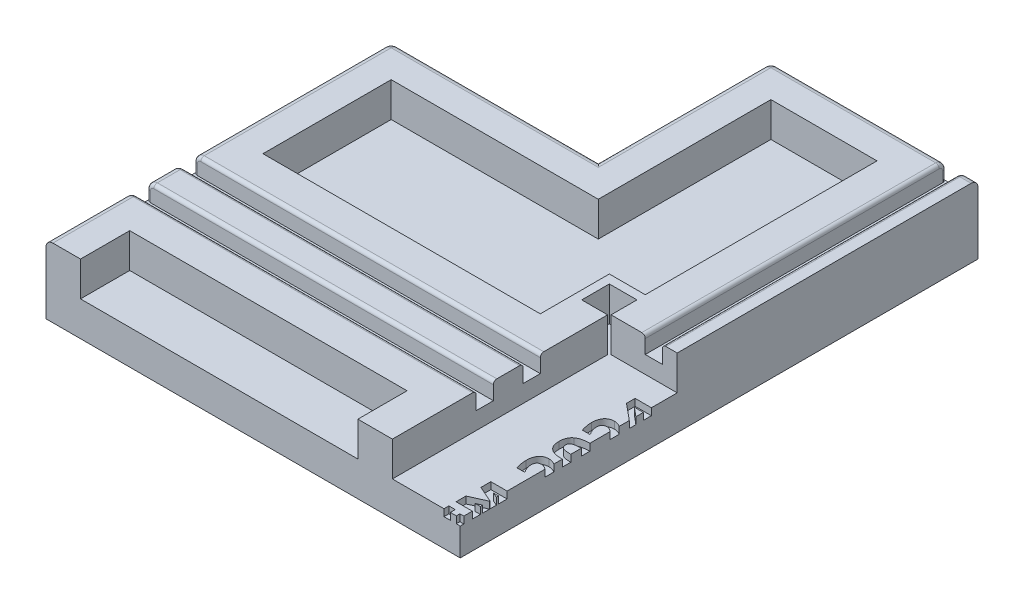
from build123d import *

# Parameters (mm, degrees)
SKETCH1_W                                  = 240
SKETCH1_H                                  = 200
BOSS_EXTRUDE1_DEPTH                        = 20
SKETCH7_W                                  = 120
SKETCH7_H                                  = 50
BOSS_EXTRUDE6_DEPTH                        = 20
FILLET1_R                                  = 2
SKETCH2_W                                  = 39.3
SKETCH2_H                                  = 125.7
CUT_EXTRUDE1_DEPTH                         = 10
CUT_EXTRUDE3_DEPTH                         = 5
MIRROR4_AT_THE_SECOND_PLANE_COPY_1_DEPTH   = 5
SKETCH11_W                                 = 104.748042719
SKETCH11_H                                 = 5
CUT_EXTRUDE4_DEPTH                         = 5
MIRROR6_AT_THE_SECOND_PLANE_COPY_1_SKETC_W = 104.748042719
MIRROR6_AT_THE_SECOND_PLANE_COPY_1_SKETC_H = 5
MIRROR6_AT_THE_SECOND_PLANE_COPY_1_DEPTH   = 5
SHELL1_START                               = 10
SHELL1_OUTLINE_W                           = 80.35
SHELL1_OUTLINE_H                           = 28.5
SHELL1_DEPTH                               = 10
FILLET3_R                                  = 1
SKETCH13_W                                 = 7.252545243
SKETCH13_H                                 = 2.335565418
SKETCH13_W_2                               = 1.720942939
SKETCH13_H_2                               = 2.581414408
CUT_EXTRUDE5_DEPTH                         = 2
CUT_EXTRUDE6_DEPTH                         = 10
MIRROR7_AT_THE_SECOND_PLANE_COPY_1_DEPTH   = 10
SKETCH15_W                                 = 266.75178719
SKETCH15_H                                 = 32.364197877
CUT_EXTRUDE7_DEPTH                         = 194.132079158
SKETCH16_W                                 = 161.662961075
SKETCH16_H                                 = 25.916642831
CUT_EXTRUDE8_DEPTH                         = 194.132079158


# Read off the part's stored shape, not the designer's step: Shell1
with BuildPart() as part:
    # Sketch1 → Boss-Extrude1 (new body)
    with BuildSketch(Plane(origin=(0, 0, 0), x_dir=(1, 0, 0), z_dir=(0, 1, 0))):
        Rectangle(SKETCH1_W, SKETCH1_H)
    extrude(amount=BOSS_EXTRUDE1_DEPTH)

    # Sketch7 → Boss-Extrude6 (add)
    with BuildSketch(Plane(origin=(0, 0, 0), x_dir=(1, 0, 0), z_dir=(0, 1, 0))):
        with Locations((0, 125)):
            Rectangle(SKETCH7_W, SKETCH7_H)
        with Locations((0, -125)):
            Rectangle(SKETCH7_W, SKETCH7_H)
    extrude(amount=BOSS_EXTRUDE6_DEPTH)

    # Fillet1
    fillet1_edges = [part.edges().sort_by_distance(p)[0] for p in [
        (-120, 20, 0),
        (90, 20, 100),
        (-90, 20, 100),
        (-60, 10, 150),
        (60, 10, 150),
        (-60, 20, 125),
        (0, 20, 150),
        (60, 20, 125),
        (-90, 20, -100),
        (60, 20, -125),
        (0, 20, -150),
        (60, 10, -150),
        (-60, 10, -150),
        (-60, 20, -125),
        (120, 20, 0),
        (120, 10, 100),
        (-120, 10, 100),
        (-120, 10, -100),
        (120, 10, -100),
        (90, 20, -100),
    ]]
    fillet(fillet1_edges, radius=FILLET1_R)

    # Sketch2 → Cut-Extrude1 (cut)
    with BuildSketch(Plane(origin=(0, 20, 0), x_dir=(1, 0, 0), z_dir=(0, 1, 0))):
        Rectangle(SKETCH2_W, SKETCH2_H)
    extrude(amount=-CUT_EXTRUDE1_DEPTH, mode=Mode.SUBTRACT)

    # Sketch10 → Cut-Extrude3 (cut)
    with BuildSketch(Plane(origin=(0, 20, 0), x_dir=(1, 0, 0), z_dir=(0, 1, 0))):
        Polygon((-9.25, -40.5), (-9.25, -33.162899401), (-4.25, -33.162899401), (-4.25, -40.5), (-4.25, -156.832928994), (-9.25, -156.832928994), align=None)
    cut_extrude3 = extrude(amount=-CUT_EXTRUDE3_DEPTH, mode=Mode.SUBTRACT)

    # Mirror4: Cut-Extrude3 across plane
    add(cut_extrude3.mirror(Plane(origin=(0, 0, 0), x_dir=(0, 0, 1), z_dir=(1, 0, 0))), mode=Mode.SUBTRACT)

    # Mirror4 at the second plane: Cut-Extrude3 across plane
    add(cut_extrude3.mirror(Plane.XY), mode=Mode.SUBTRACT)

    # Mirror4 at the second plane copy 1 sketc → Mirror4 at the second plane copy 1 (cut)
    with BuildSketch(Plane(origin=(0, 20, 0), x_dir=(-1, 0, 0), z_dir=(0, 1, 0))):
        Polygon((-9.25, -40.5), (-9.25, -33.162899401), (-4.25, -33.162899401), (-4.25, -40.5), (-4.25, -156.832928994), (-9.25, -156.832928994), align=None)
    extrude(amount=-MIRROR4_AT_THE_SECOND_PLANE_COPY_1_DEPTH, mode=Mode.SUBTRACT)

    # Sketch11 → Cut-Extrude4 (cut)
    with BuildSketch(Plane(origin=(0, 20, 0), x_dir=(1, 0, 0), z_dir=(0, 1, 0))):
        with Locations((-72.024021359, 26.75)):
            Rectangle(SKETCH11_W, SKETCH11_H)
        with Locations((-72.024021359, 40.35)):
            Rectangle(SKETCH11_W, SKETCH11_H)
    cut_extrude4 = extrude(amount=-CUT_EXTRUDE4_DEPTH, mode=Mode.SUBTRACT)

    # Mirror6: Cut-Extrude4 across plane
    add(cut_extrude4.mirror(Plane.XY), mode=Mode.SUBTRACT)

    # Mirror6 at the second plane: Cut-Extrude4 across plane
    add(cut_extrude4.mirror(Plane(origin=(0, 0, 0), x_dir=(0, 0, 1), z_dir=(1, 0, 0))), mode=Mode.SUBTRACT)

    # Mirror6 at the second plane copy 1 sketc → Mirror6 at the second plane copy 1 (cut)
    with BuildSketch(Plane(origin=(0, 20, 0), x_dir=(-1, 0, 0), z_dir=(0, 1, 0))):
        with Locations((-72.024021359, 26.75)):
            Rectangle(MIRROR6_AT_THE_SECOND_PLANE_COPY_1_SKETC_W, MIRROR6_AT_THE_SECOND_PLANE_COPY_1_SKETC_H)
        with Locations((-72.024021359, 40.35)):
            Rectangle(MIRROR6_AT_THE_SECOND_PLANE_COPY_1_SKETC_W, MIRROR6_AT_THE_SECOND_PLANE_COPY_1_SKETC_H)
    extrude(amount=-MIRROR6_AT_THE_SECOND_PLANE_COPY_1_DEPTH, mode=Mode.SUBTRACT)

    # Shell1 outline → Shell1 (cut)
    with BuildSketch(Plane(origin=(0, 0, 0), x_dir=(1, 0, 0), z_dir=(0, 1, 0)).offset(SHELL1_START)):
        Polygon((-29.65, 72.85), (-19.25, 72.85), (-19.25, 140), (-50, 140), (-50, 90), (-110, 90), (-110, 52.85), (-29.65, 52.85), align=None)
        Polygon((19.25, 72.85), (29.65, 72.85), (29.65, 52.85), (110, 52.85), (110, 90), (50, 90), (50, 140), (19.25, 140), align=None)
        Polygon((-110, -52.85), (-110, -90), (-50, -90), (-50, -140), (-19.25, -140), (-19.25, -72.85), (-29.65, -72.85), (-29.65, -52.85), align=None)
        with Locations((-69.825, 0)):
            Rectangle(SHELL1_OUTLINE_W, SHELL1_OUTLINE_H)
        Polygon((29.65, -72.85), (19.25, -72.85), (19.25, -140), (50, -140), (50, -90), (110, -90), (110, -52.85), (29.65, -52.85), align=None)
        with Locations((69.825, 0)):
            Rectangle(SHELL1_OUTLINE_W, SHELL1_OUTLINE_H)
    extrude(amount=SHELL1_DEPTH, mode=Mode.SUBTRACT)

    # Fillet3
    fillet3_edges = [part.edges().sort_by_distance(p)[0] for p in [
        (-4.25, 16.5, 150),
        (-4.25, 19.414213562, 149.414213562),
        (-9.25, 16.5, 150),
        (-9.25, 19.414213562, 149.414213562),
        (-4.25, 20, 105.425),
        (-9.25, 20, 105.425),
        (-9.25, 19.414213562, -149.414213562),
        (-9.25, 16.5, -150),
        (-9.25, 20, -105.425),
        (-4.25, 16.5, -150),
        (-4.25, 19.414213562, -149.414213562),
        (-4.25, 20, -105.425),
        (9.25, 16.5, 150),
        (9.25, 20, 105.425),
        (9.25, 19.414213562, 149.414213562),
        (4.25, 16.5, 150),
        (4.25, 19.414213562, 149.414213562),
        (4.25, 20, 105.425),
        (4.25, 16.5, -150),
        (4.25, 19.414213562, -149.414213562),
        (9.25, 19.414213562, -149.414213562),
        (9.25, 16.5, -150),
        (4.25, 20, -105.425),
        (9.25, 20, -105.425),
        (-120, 16.5, -24.25),
        (-120, 16.5, -29.25),
        (-119.414213562, 19.414213562, -24.25),
        (-119.414213562, 19.414213562, -29.25),
        (-68.825, 20, -24.25),
        (-68.825, 20, -29.25),
        (-120, 16.5, -37.85),
        (-120, 16.5, -42.85),
        (-68.825, 20, -37.85),
        (-68.825, 20, -42.85),
        (-119.414213562, 19.414213562, -37.85),
        (-119.414213562, 19.414213562, -42.85),
        (68.825, 20, -29.25),
        (119.414213562, 19.414213562, -29.25),
        (119.414213562, 19.414213562, -24.25),
        (68.825, 20, -24.25),
        (120, 16.5, -29.25),
        (120, 16.5, -24.25),
        (68.825, 20, -42.85),
        (119.414213562, 19.414213562, -42.85),
        (119.414213562, 19.414213562, -37.85),
        (68.825, 20, -37.85),
        (120, 16.5, -42.85),
        (120, 16.5, -37.85),
        (-120, 16.5, 29.25),
        (-120, 16.5, 24.25),
        (-68.825, 20, 29.25),
        (-119.414213562, 19.414213562, 29.25),
        (-119.414213562, 19.414213562, 24.25),
        (-68.825, 20, 24.25),
        (-120, 16.5, 42.85),
        (-120, 16.5, 37.85),
        (-68.825, 20, 42.85),
        (-119.414213562, 19.414213562, 42.85),
        (-119.414213562, 19.414213562, 37.85),
        (-68.825, 20, 37.85),
        (120, 16.5, 24.25),
        (120, 16.5, 29.25),
        (119.414213562, 19.414213562, 24.25),
        (119.414213562, 19.414213562, 29.25),
        (68.825, 20, 24.25),
        (68.825, 20, 29.25),
        (120, 16.5, 37.85),
        (120, 16.5, 42.85),
        (68.825, 20, 37.85),
        (68.825, 20, 42.85),
        (119.414213562, 19.414213562, 37.85),
        (119.414213562, 19.414213562, 42.85),
    ]]
    fillet(fillet3_edges, radius=FILLET3_R)

    # Sketch13 → Cut-Extrude5 (cut)
    # profile 1 of 12: a face of its own
    with BuildSketch(Plane(origin=(0, 10, 0), x_dir=(1, 0, 0), z_dir=(0, 1, 0))):
        Polygon((2.787359078, 56.729654742), (2.787359078, 55.37748529), (5, 55.37748529), (5, 53.041919872), (2.787359078, 53.041919872), (2.787359078, 48.247864542), (0.880108701, 48.247864542), (-4.711035156, 52.886343558), (-4.711035156, 55.37748529), (0.943491644, 55.37748529), (0.943491644, 56.729654742), align=None)
        Polygon((0.943491644, 53.041919872), (-2.596349692, 53.041919872), (0.943491644, 50.110938929), align=None, mode=Mode.SUBTRACT)
    # profile 2 of 12: a face of its own
    with BuildSketch(Plane(origin=(0, 10, 0), x_dir=(1, 0, 0), z_dir=(0, 1, 0))):
        with BuildLine():
            Line((5, 47.141544081), (5, 39.520225351))
            Line((5, 39.520225351), (3.409664338, 39.520225351))
            add(Edge.make_bspline(
                [(3.409664338, 39.520225351), (3.190599668, 39.81675512), (2.747057383, 40.417141716), (2.167094132, 41.14339637), (1.704390868, 41.703253096), (1.381972101, 42.083056551), (1.083256561, 42.417759603), (0.887687077, 42.622007507), (0.79559811, 42.718182933)],
                knots=[0, 0, 0, 0, 1.605452287, 3.25057426, 4.046675402, 4.768563423, 5.420146126, 6, 6, 6, 6], degree=3))
            add(Edge.make_bspline(
                [(0.79559811, 42.718182933), (0.732570292, 42.782561984), (0.609352585, 42.908421315), (0.423765416, 43.085974145), (0.244476812, 43.249198615), (0.074088064, 43.400664381), (-0.092796487, 43.534082219), (-0.252790737, 43.654099684), (-0.406497488, 43.759962438), (-0.599845109, 43.881290453), (-0.837875375, 44.00401532), (-1.125540586, 44.112139625), (-1.412736444, 44.178491494), (-1.604945873, 44.187117789), (-1.699385013, 44.191356186)],
                knots=[0, 0, 0, 0, 1.090093853, 2.131104457, 3.107135244, 4.023908394, 4.888948297, 5.691514549, 6.4435893, 7.146498757, 8.452673016, 9.675803408, 10.85804184, 12, 12, 12, 12], degree=3))
            add(Edge.make_bspline(
                [(-1.699385013, 44.191356186), (-1.754483363, 44.189605987), (-1.861179083, 44.186216799), (-2.017224671, 44.167846758), (-2.162681909, 44.132103765), (-2.300488192, 44.087839319), (-2.42643972, 44.024206924), (-2.544199113, 43.950411254), (-2.650531499, 43.859818439), (-2.749307162, 43.758726543), (-2.834556733, 43.642742478), (-2.911599654, 43.517157005), (-2.971430142, 43.377241787), (-3.024398474, 43.226819474), (-3.063653395, 43.063897589), (-3.092633036, 42.889340485), (-3.109905835, 42.703165878), (-3.111960528, 42.574807759), (-3.113016713, 42.508827152)],
                knots=[0, 0, 0, 0, 1.058578686, 2.049894692, 3.010224385, 3.931750511, 4.822578239, 5.71281177, 6.594427321, 7.498813824, 8.420995957, 9.353043897, 10.321837571, 11.3367408, 12.413304787, 13.535187771, 14.732999458, 16, 16, 16, 16], degree=3))
            add(Edge.make_bspline(
                [(-3.113016713, 42.508827152), (-3.110052719, 42.405568465), (-3.104041103, 42.196137688), (-3.053985994, 41.878413923), (-2.980602684, 41.552282773), (-2.873221808, 41.222921491), (-2.74714341, 40.895094854), (-2.596251992, 40.578640505), (-2.438170844, 40.269132893), (-2.314289691, 40.074405983), (-2.252545243, 39.977350819)],
                knots=[0, 0, 0, 0, 0.914703558, 1.855215137, 2.844920106, 3.875005138, 4.922433174, 5.955639304, 6.981056277, 8, 8, 8, 8], degree=3))
            Line((-2.252545243, 39.977350819), (-2.252545243, 39.766074342))
            Line((-2.252545243, 39.766074342), (-4.363389317, 39.766074342))
            add(Edge.make_bspline(
                [(-4.363389317, 39.766074342), (-4.396975153, 39.85152697), (-4.470639347, 40.038951181), (-4.568658946, 40.352153969), (-4.66491051, 40.720660415), (-4.763825821, 41.132864511), (-4.849735205, 41.573321973), (-4.910075419, 42.024211578), (-4.95119256, 42.474770211), (-4.954991729, 42.775713815), (-4.956884148, 42.92561802)],
                knots=[0, 0, 0, 0, 0.681686624, 1.495150967, 2.435076171, 3.509887788, 4.642826517, 5.765734475, 6.887081194, 8, 8, 8, 8], degree=3))
            add(Edge.make_bspline(
                [(-4.956884148, 42.92561802), (-4.954912362, 43.072306092), (-4.951074185, 43.357841566), (-4.914531776, 43.772464491), (-4.853049644, 44.160650299), (-4.769612134, 44.521836328), (-4.662431161, 44.856562797), (-4.529987596, 45.163893905), (-4.371768891, 45.443672956), (-4.191325, 45.69718541), (-3.986517109, 45.920499957), (-3.762299213, 46.116633841), (-3.516918106, 46.283180062), (-3.250583577, 46.417510178), (-2.964907945, 46.521931142), (-2.659732708, 46.596780352), (-2.333869778, 46.641015432), (-2.109911454, 46.646854566), (-1.995172081, 46.649846099)],
                knots=[0, 0, 0, 0, 1.302669921, 2.535710425, 3.693104205, 4.791067539, 5.825099944, 6.810730835, 7.758000335, 8.67487823, 9.568447078, 10.443087854, 11.315285082, 12.19521531, 13.085757283, 14.011200708, 14.981089066, 16, 16, 16, 16], degree=3))
            add(Edge.make_bspline(
                [(-1.995172081, 46.649846099), (-1.918295051, 46.648245135), (-1.764899121, 46.645050664), (-1.536586701, 46.623146341), (-1.311198259, 46.589276583), (-1.089189633, 46.538876948), (-0.870129482, 46.472993238), (-0.653296175, 46.39436831), (-0.439122967, 46.302496277), (-0.229338943, 46.193054838), (-0.018163961, 46.072147599), (0.191952814, 45.932794317), (0.405837655, 45.781094454), (0.620958688, 45.614342324), (0.835471411, 45.430057751), (1.055741697, 45.23549192), (1.273520634, 45.021368665), (1.417594688, 44.872241147), (1.490889788, 44.796375188)],
                knots=[0, 0, 0, 0, 0.907170522, 1.810115022, 2.704515666, 3.595334857, 4.494160497, 5.402400165, 6.316123003, 7.242010315, 8.19323076, 9.186549597, 10.215937183, 11.28746875, 12.397107329, 13.552885457, 14.755074217, 16, 16, 16, 16], degree=3))
            add(Edge.make_bspline(
                [(1.490889788, 44.796375188), (1.669671754, 44.600991906), (2.021428479, 44.216571794), (2.422503942, 43.720261203), (2.710127438, 43.347225494), (2.892573427, 43.11547907), (3.035611297, 42.923413887), (3.11966375, 42.809753418), (3.156132565, 42.760438229)],
                knots=[0, 0, 0, 0, 1.811045763, 3.563265038, 4.362127914, 5.033096026, 5.580478129, 6, 6, 6, 6], degree=3))
            Line((3.156132565, 42.760438229), (3.156132565, 47.141544081))
            Line((3.156132565, 47.141544081), (5, 47.141544081))
        make_face()
    # profile 3 of 12: a face of its own
    with BuildSketch(Plane(origin=(0, 10, 0), x_dir=(1, 0, 0), z_dir=(0, 1, 0))):
        with BuildLine():
            add(Edge.make_bspline(
                [(0.138720336, 37.553433421), (0.339837036, 37.551198694), (0.731017162, 37.546852061), (1.301575539, 37.503210957), (1.839727263, 37.435290008), (2.344336806, 37.340402007), (2.812295891, 37.218717557), (3.235819492, 37.059739443), (3.620265586, 36.877229499), (3.845547684, 36.720963882), (3.955141787, 36.64494457)],
                knots=[0, 0, 0, 0, 1.210994604, 2.355433537, 3.443919748, 4.476135166, 5.446013627, 6.351277171, 7.197937607, 8, 8, 8, 8], degree=3))
            add(Edge.make_bspline(
                [(3.955141787, 36.64494457), (4.057367971, 36.5617232), (4.260610648, 36.396265258), (4.524020765, 36.101981434), (4.745368417, 35.772676286), (4.897303004, 35.472877401), (4.999247268, 35.217133399), (5.063592063, 35.011802969), (5.122267484, 34.796985151), (5.167723638, 34.570405454), (5.201934481, 34.333084121), (5.226664862, 34.085073274), (5.242295446, 33.825562266), (5.244648027, 33.648682389), (5.245848991, 33.558387312)],
                knots=[0, 0, 0, 0, 1.363120718, 2.710110989, 4.070537742, 5.460816644, 6.180869889, 6.918733188, 7.687278466, 8.485437086, 9.309407483, 10.168795045, 11.065191617, 12, 12, 12, 12], degree=3))
            add(Edge.make_bspline(
                [(5.245848991, 33.558387312), (5.241905689, 33.384062955), (5.234297073, 33.047703496), (5.173081199, 32.562988904), (5.069699732, 32.118069919), (4.926806373, 31.711596248), (4.739854178, 31.34454147), (4.516760058, 31.013155063), (4.251279595, 30.717979546), (4.045332533, 30.554230832), (3.94169692, 30.471830054)],
                knots=[0, 0, 0, 0, 1.200851745, 2.317047666, 3.359233085, 4.342911255, 5.278031965, 6.189548012, 7.088953741, 8, 8, 8, 8], degree=3))
            add(Edge.make_bspline(
                [(3.94169692, 30.471830054), (3.829424185, 30.3947628), (3.600170882, 30.2373967), (3.214838014, 30.049115343), (2.792701976, 29.89168932), (2.331256748, 29.768085058), (1.834031119, 29.675388633), (1.301418942, 29.61187027), (0.734794995, 29.570336966), (0.344952566, 29.565716964), (0.144482422, 29.563341204)],
                knots=[0, 0, 0, 0, 0.822750793, 1.680001256, 2.58557045, 3.544707477, 4.565467581, 5.642347189, 6.787615291, 8, 8, 8, 8], degree=3))
            add(Edge.make_bspline(
                [(0.144482422, 29.563341204), (-0.061754837, 29.565532126), (-0.459970452, 29.569762495), (-1.036345286, 29.613069323), (-1.570746564, 29.680774054), (-2.065452333, 29.775711056), (-2.521358164, 29.900947264), (-2.938473361, 30.06222162), (-3.323134476, 30.249194002), (-3.55325365, 30.406272972), (-3.666176943, 30.483354226)],
                knots=[0, 0, 0, 0, 1.242237956, 2.39858964, 3.479780431, 4.485821505, 5.430991799, 6.32348679, 7.177307181, 8, 8, 8, 8], degree=3))
            add(Edge.make_bspline(
                [(-3.666176943, 30.483354226), (-3.769193286, 30.566416838), (-3.974708441, 30.732124775), (-4.238285133, 31.029639616), (-4.461065672, 31.362253167), (-4.645070962, 31.729678272), (-4.784115122, 32.135791847), (-4.885860052, 32.577168574), (-4.944671996, 33.056148657), (-4.952723667, 33.387282789), (-4.956884148, 33.558387312)],
                knots=[0, 0, 0, 0, 0.915406887, 1.826214983, 2.74012738, 3.682217607, 4.664024873, 5.706462388, 6.814877053, 8, 8, 8, 8], degree=3))
            add(Edge.make_bspline(
                [(-4.956884148, 33.558387312), (-4.955682618, 33.64868302), (-4.953320425, 33.826203271), (-4.937576888, 34.086978277), (-4.913381513, 34.337057391), (-4.877300412, 34.575699285), (-4.828262853, 34.80214551), (-4.773499009, 35.018778584), (-4.706561244, 35.224310597), (-4.601886899, 35.480626422), (-4.447267393, 35.781827029), (-4.217150947, 36.109134402), (-3.948246131, 36.405401156), (-3.739143401, 36.569659884), (-3.633525124, 36.652627351)],
                knots=[0, 0, 0, 0, 0.927772364, 1.823989051, 2.683453821, 3.508702832, 4.302191287, 5.063276402, 5.803871599, 6.520953588, 7.906777029, 9.27188215, 10.622021304, 12, 12, 12, 12], degree=3))
            add(Edge.make_bspline(
                [(-3.633525124, 36.652627351), (-3.521300204, 36.729189524), (-3.292789343, 36.885084383), (-2.908970475, 37.068290297), (-2.492360426, 37.225455121), (-2.036263275, 37.346342452), (-1.54437137, 37.439204828), (-1.015826808, 37.505677425), (-0.450933502, 37.546286922), (-0.061742996, 37.551003841), (0.138720336, 37.553433421)],
                knots=[0, 0, 0, 0, 0.826423845, 1.682753026, 2.582377666, 3.535958882, 4.552416628, 5.629628825, 6.779074777, 8, 8, 8, 8], degree=3))
        make_face()
        with BuildLine():
            add(Edge.make_bspline(
                [(0.138720336, 35.094943508), (-0.002794049, 35.093990238), (-0.275052116, 35.092156251), (-0.667644343, 35.074004214), (-1.028464631, 35.048543297), (-1.357952356, 35.010483072), (-1.656192237, 34.961169576), (-1.923473104, 34.900935006), (-2.158488294, 34.828227196), (-2.363936988, 34.745989678), (-2.54162794, 34.64913888), (-2.69467252, 34.537908006), (-2.823572221, 34.410664927), (-2.931286275, 34.270097317), (-3.011274034, 34.111739825), (-3.072443859, 33.941187009), (-3.106785969, 33.754382189), (-3.110895684, 33.625106618), (-3.113016713, 33.558387312)],
                knots=[0, 0, 0, 0, 1.684598718, 3.240982106, 4.677870026, 5.990101975, 7.188004416, 8.275163324, 9.249099904, 10.113910365, 10.905306099, 11.652292794, 12.358339015, 13.054983843, 13.750418457, 14.461547751, 15.206002611, 16, 16, 16, 16], degree=3))
            add(Edge.make_bspline(
                [(-3.113016713, 33.558387312), (-3.110895681, 33.491668012), (-3.106785962, 33.362392453), (-3.072443884, 33.175587552), (-3.011273943, 33.005035023), (-2.931286606, 32.84667649), (-2.823570979, 32.706112772), (-2.694677343, 32.578854684), (-2.541608299, 32.467684345), (-2.363496496, 32.37029911), (-2.157013742, 32.289020864), (-1.921590867, 32.215742751), (-1.654258135, 32.155647372), (-1.355414385, 32.106122047), (-1.024612933, 32.068276855), (-0.661244964, 32.04269777), (-0.266085327, 32.024665897), (0.008090715, 32.022799039), (0.150244508, 32.021831116)],
                knots=[0, 0, 0, 0, 0.791766581, 1.534129826, 2.243261137, 2.936741863, 3.631429404, 4.335491923, 5.08037989, 5.869552125, 6.738971147, 7.710171362, 8.794275798, 9.988812621, 11.304907075, 12.745337551, 14.312534512, 16, 16, 16, 16], degree=3))
            add(Edge.make_bspline(
                [(0.150244508, 32.021831116), (0.289201434, 32.022765136), (0.556986265, 32.024565091), (0.943773412, 32.043063349), (1.30096878, 32.067483158), (1.627502144, 32.109075315), (1.924420257, 32.156514098), (2.190195476, 32.220950105), (2.427221865, 32.292197549), (2.635687527, 32.376524358), (2.816464841, 32.475577579), (2.974492505, 32.586386469), (3.106149375, 32.714997304), (3.215613674, 32.855867424), (3.298888327, 33.012083539), (3.358752163, 33.181622444), (3.396338685, 33.365314373), (3.400067537, 33.492898418), (3.401981557, 33.558387312)],
                knots=[0, 0, 0, 0, 1.658832269, 3.196746878, 4.622488866, 5.931787449, 7.125569234, 8.210133994, 9.194149195, 10.078471196, 10.889203548, 11.650697572, 12.375032472, 13.07829054, 13.77251817, 14.478471121, 15.218999177, 16, 16, 16, 16], degree=3))
            add(Edge.make_bspline(
                [(3.401981557, 33.558387312), (3.400068186, 33.623876875), (3.3963406, 33.751462223), (3.358745104, 33.935144911), (3.298913291, 34.10471679), (3.215521541, 34.260812329), (3.106775331, 34.40178813), (2.97377315, 34.528364287), (2.816557237, 34.639341559), (2.635707586, 34.738476019), (2.42683161, 34.821967534), (2.190341985, 34.897522561), (1.921851262, 34.956560743), (1.624132619, 35.009519497), (1.295502071, 35.045529443), (0.936895825, 35.074962985), (0.547988509, 35.091838226), (0.278306115, 35.093884415), (0.138720336, 35.094943508)],
                knots=[0, 0, 0, 0, 0.778971247, 1.517574904, 2.221693305, 2.914116855, 3.615547377, 4.332711038, 5.092226179, 5.900851692, 6.782875619, 7.766611013, 8.854037796, 10.053520173, 11.366075456, 12.788704916, 14.337855446, 16, 16, 16, 16], degree=3))
        make_face(mode=Mode.SUBTRACT)
    # profile 4 of 12: a face of its own
    with BuildSketch(Plane(origin=(0, 10, 0), x_dir=(1, 0, 0), z_dir=(0, 1, 0))):
        with BuildLine():
            Line((5, 28.211171751), (5, 20.589853021))
            Line((5, 20.589853021), (3.409664338, 20.589853021))
            add(Edge.make_bspline(
                [(3.409664338, 20.589853021), (3.190599668, 20.88638279), (2.747057383, 21.486769386), (2.167094132, 22.21302404), (1.704390868, 22.772880767), (1.381972101, 23.152684221), (1.083256561, 23.487387273), (0.887687077, 23.691635177), (0.79559811, 23.787810603)],
                knots=[0, 0, 0, 0, 1.605452287, 3.25057426, 4.046675402, 4.768563423, 5.420146126, 6, 6, 6, 6], degree=3))
            add(Edge.make_bspline(
                [(0.79559811, 23.787810603), (0.732570292, 23.852189654), (0.609352585, 23.978048985), (0.423765416, 24.155601815), (0.244476812, 24.318826285), (0.074088064, 24.470292051), (-0.092796487, 24.60370989), (-0.252790737, 24.723727355), (-0.406497488, 24.829590108), (-0.599845109, 24.950918123), (-0.837875375, 25.07364299), (-1.125540586, 25.181767295), (-1.412736444, 25.248119164), (-1.604945873, 25.256745459), (-1.699385013, 25.260983856)],
                knots=[0, 0, 0, 0, 1.090093853, 2.131104457, 3.107135244, 4.023908394, 4.888948297, 5.691514549, 6.4435893, 7.146498757, 8.452673016, 9.675803408, 10.85804184, 12, 12, 12, 12], degree=3))
            add(Edge.make_bspline(
                [(-1.699385013, 25.260983856), (-1.754483363, 25.259233658), (-1.861179083, 25.25584447), (-2.017224671, 25.237474428), (-2.162681909, 25.201731435), (-2.300488192, 25.157466989), (-2.42643972, 25.093834595), (-2.544199113, 25.020038924), (-2.650531499, 24.929446109), (-2.749307162, 24.828354213), (-2.834556733, 24.712370148), (-2.911599654, 24.586784675), (-2.971430142, 24.446869457), (-3.024398474, 24.296447144), (-3.063653395, 24.133525259), (-3.092633036, 23.958968155), (-3.109905835, 23.772793548), (-3.111960528, 23.644435429), (-3.113016713, 23.578454822)],
                knots=[0, 0, 0, 0, 1.058578686, 2.049894692, 3.010224385, 3.931750511, 4.822578239, 5.71281177, 6.594427321, 7.498813824, 8.420995957, 9.353043897, 10.321837571, 11.3367408, 12.413304787, 13.535187771, 14.732999458, 16, 16, 16, 16], degree=3))
            add(Edge.make_bspline(
                [(-3.113016713, 23.578454822), (-3.110052719, 23.475196136), (-3.104041103, 23.265765358), (-3.053985994, 22.948041593), (-2.980602684, 22.621910443), (-2.873221808, 22.292549161), (-2.74714341, 21.964722525), (-2.596251992, 21.648268175), (-2.438170844, 21.338760563), (-2.314289691, 21.144033653), (-2.252545243, 21.046978489)],
                knots=[0, 0, 0, 0, 0.914703558, 1.855215137, 2.844920106, 3.875005138, 4.922433174, 5.955639304, 6.981056277, 8, 8, 8, 8], degree=3))
            Line((-2.252545243, 21.046978489), (-2.252545243, 20.835702012))
            Line((-2.252545243, 20.835702012), (-4.363389317, 20.835702012))
            add(Edge.make_bspline(
                [(-4.363389317, 20.835702012), (-4.396975153, 20.92115464), (-4.470639347, 21.108578851), (-4.568658946, 21.421781639), (-4.66491051, 21.790288086), (-4.763825821, 22.202492181), (-4.849735205, 22.642949643), (-4.910075419, 23.093839248), (-4.95119256, 23.544397881), (-4.954991729, 23.845341485), (-4.956884148, 23.99524569)],
                knots=[0, 0, 0, 0, 0.681686624, 1.495150967, 2.435076171, 3.509887788, 4.642826517, 5.765734475, 6.887081194, 8, 8, 8, 8], degree=3))
            add(Edge.make_bspline(
                [(-4.956884148, 23.99524569), (-4.954912362, 24.141933762), (-4.951074185, 24.427469237), (-4.914531776, 24.842092162), (-4.853049644, 25.230277969), (-4.769612134, 25.591463998), (-4.662431161, 25.926190468), (-4.529987596, 26.233521576), (-4.371768891, 26.513300626), (-4.191325, 26.76681308), (-3.986517109, 26.990127627), (-3.762299213, 27.186261512), (-3.516918106, 27.352807733), (-3.250583577, 27.487137848), (-2.964907945, 27.591558812), (-2.659732708, 27.666408023), (-2.333869778, 27.710643103), (-2.109911454, 27.716482236), (-1.995172081, 27.719473769)],
                knots=[0, 0, 0, 0, 1.302669921, 2.535710425, 3.693104205, 4.791067539, 5.825099944, 6.810730835, 7.758000335, 8.67487823, 9.568447078, 10.443087854, 11.315285082, 12.19521531, 13.085757283, 14.011200708, 14.981089066, 16, 16, 16, 16], degree=3))
            add(Edge.make_bspline(
                [(-1.995172081, 27.719473769), (-1.918295051, 27.717872805), (-1.764899121, 27.714678334), (-1.536586701, 27.692774011), (-1.311198259, 27.658904253), (-1.089189633, 27.608504619), (-0.870129482, 27.542620908), (-0.653296175, 27.46399598), (-0.439122967, 27.372123947), (-0.229338943, 27.262682508), (-0.018163961, 27.141775269), (0.191952814, 27.002421987), (0.405837655, 26.850722124), (0.620958688, 26.683969994), (0.835471411, 26.499685422), (1.055741697, 26.30511959), (1.273520634, 26.090996335), (1.417594688, 25.941868817), (1.490889788, 25.866002858)],
                knots=[0, 0, 0, 0, 0.907170522, 1.810115022, 2.704515666, 3.595334857, 4.494160497, 5.402400165, 6.316123003, 7.242010315, 8.19323076, 9.186549597, 10.215937183, 11.28746875, 12.397107329, 13.552885457, 14.755074217, 16, 16, 16, 16], degree=3))
            add(Edge.make_bspline(
                [(1.490889788, 25.866002858), (1.669671754, 25.670619576), (2.021428479, 25.286199464), (2.422503942, 24.789888873), (2.710127438, 24.416853164), (2.892573427, 24.18510674), (3.035611297, 23.993041557), (3.11966375, 23.879381088), (3.156132565, 23.830065899)],
                knots=[0, 0, 0, 0, 1.811045763, 3.563265038, 4.362127914, 5.033096026, 5.580478129, 6, 6, 6, 6], degree=3))
            Line((3.156132565, 23.830065899), (3.156132565, 28.211171751))
            Line((3.156132565, 28.211171751), (5, 28.211171751))
        make_face()
    # profile 5 of 12: a face of its own
    with BuildSketch(Plane(origin=(0, 10, 0), x_dir=(1, 0, 0), z_dir=(0, 1, 0))):
        Polygon((5, 13.583156769), (5, 11.124666856), (-1.524601746, 11.124666856), (2.664434583, 9.338420279), (2.664434583, 7.625160121), (-1.524601746, 5.838913543), (5, 5.838913543), (5, 3.503348126), (-4.711035156, 3.503348126), (-4.711035156, 6.382470298), (0.125275469, 8.549014533), (-4.711035156, 10.709796683), (-4.711035156, 13.583156769), align=None)
    # profile 6 of 12: a face of its own
    with BuildSketch(Plane(origin=(0, 10, 0), x_dir=(1, 0, 0), z_dir=(0, 1, 0))):
        Polygon((5, 1.4136317), (5, -5.593064552), (-4.711035156, -5.593064552), (-4.711035156, 1.4136317), (-2.867167722, 1.4136317), (-2.867167722, -3.134574639), (-1.146224782, -3.134574639), (-1.146224782, 1.044858213), (0.697642652, 1.044858213), (0.697642652, -3.134574639), (3.156132565, -3.134574639), (3.156132565, 1.4136317), align=None)
    # profile 7 of 12: a face of its own
    with BuildSketch(Plane(origin=(0, 10, 0), x_dir=(1, 0, 0), z_dir=(0, 1, 0))):
        with BuildLine():
            add(Edge.make_bspline(
                [(4.475650198, -7.805705474), (4.519354839, -7.923859504), (4.612512661, -8.17570855), (4.743574124, -8.583890089), (4.866671289, -9.047274178), (4.996208031, -9.552124696), (5.106381276, -10.084227717), (5.187397941, -10.625264318), (5.237323662, -11.165972628), (5.243010567, -11.526628491), (5.245848991, -11.706637515)],
                knots=[0, 0, 0, 0, 0.756485239, 1.612472169, 2.573171414, 3.635272123, 4.742182008, 5.834553763, 6.919191659, 8, 8, 8, 8], degree=3))
            add(Edge.make_bspline(
                [(5.245848991, -11.706637515), (5.241962961, -11.909112321), (5.234392087, -12.303579456), (5.17063924, -12.878829296), (5.062937634, -13.419584917), (4.916847086, -13.928231287), (4.72267015, -14.400885619), (4.491042888, -14.842463027), (4.211679163, -15.247896521), (3.893490591, -15.618759753), (3.53655883, -15.9505899), (3.145758166, -16.239699566), (2.72146993, -16.48347792), (2.264846611, -16.681095463), (1.776896349, -16.838089964), (1.255150105, -16.944841813), (0.702111097, -17.014888699), (0.322052776, -17.021601157), (0.127196165, -17.025042647)],
                knots=[0, 0, 0, 0, 1.160705024, 2.261318311, 3.313123859, 4.319096107, 5.290496718, 6.238021168, 7.172737693, 8.107230733, 9.03451477, 9.961071912, 10.888559376, 11.833805606, 12.808979065, 13.821966168, 14.883317984, 16, 16, 16, 16], degree=3))
            add(Edge.make_bspline(
                [(0.127196165, -17.025042647), (-0.058682323, -17.02067815), (-0.422730133, -17.012130168), (-0.955049114, -16.943336637), (-1.460067022, -16.832867692), (-1.937766829, -16.677677821), (-2.386372436, -16.473696921), (-2.808700267, -16.227656485), (-3.203463564, -15.935836699), (-3.565000576, -15.598836264), (-3.895700628, -15.226075236), (-4.177610929, -14.810267907), (-4.422741814, -14.363406013), (-4.616779655, -13.8775432), (-4.772219277, -13.359136807), (-4.876169413, -12.804694831), (-4.946971316, -12.216810998), (-4.953520434, -11.812500101), (-4.956884148, -11.604840667)],
                knots=[0, 0, 0, 0, 1.061573339, 2.079118747, 3.060574866, 4.011305467, 4.942696719, 5.870461571, 6.798745348, 7.740825567, 8.68941507, 9.638984161, 10.604583371, 11.595514188, 12.621960228, 13.691449096, 14.814297672, 16, 16, 16, 16], degree=3))
            add(Edge.make_bspline(
                [(-4.956884148, -11.604840667), (-4.954318925, -11.445386322), (-4.949235323, -11.129389392), (-4.919388643, -10.661251886), (-4.863951384, -10.205248288), (-4.792453594, -9.753475749), (-4.684946461, -9.294730481), (-4.534849919, -8.818874824), (-4.346707534, -8.316660693), (-4.193287983, -7.980233106), (-4.113698935, -7.805705474)],
                knots=[0, 0, 0, 0, 0.974479143, 1.931163549, 2.86485946, 3.780778834, 4.725046501, 5.741022375, 6.828116267, 8, 8, 8, 8], degree=3))
            Line((-4.113698935, -7.805705474), (-1.883771756, -7.805705474))
            Line((-1.883771756, -7.805705474), (-1.883771756, -8.091889065))
            add(Edge.make_bspline(
                [(-1.883771756, -8.091889065), (-1.906716104, -8.126531064), (-1.957410079, -8.203070203), (-2.043059993, -8.326945943), (-2.137489474, -8.476111594), (-2.284548962, -8.694884397), (-2.45960062, -8.978067997), (-2.581693909, -9.213466955), (-2.640525683, -9.326896107)],
                knots=[0, 0, 0, 0, 0.515980687, 1.140024195, 1.869947604, 2.707876564, 4.413660046, 6, 6, 6, 6], degree=3))
            add(Edge.make_bspline(
                [(-2.640525683, -9.326896107), (-2.672756546, -9.393740863), (-2.73882048, -9.530753251), (-2.823836627, -9.749019276), (-2.905177649, -9.981830174), (-2.978097, -10.22950925), (-3.037034138, -10.489919732), (-3.082413494, -10.759686706), (-3.106467195, -11.03779789), (-3.110821171, -11.225783758), (-3.113016713, -11.320577771)],
                knots=[0, 0, 0, 0, 0.861448091, 1.765719082, 2.717953576, 3.724891765, 4.761927522, 5.816719679, 6.89905606, 8, 8, 8, 8], degree=3))
            add(Edge.make_bspline(
                [(-3.113016713, -11.320577771), (-3.110164997, -11.430782772), (-3.104578279, -11.646682304), (-3.068710383, -11.963218824), (-3.004292393, -12.263584213), (-2.918860854, -12.549882667), (-2.805175217, -12.820581595), (-2.662381265, -13.075068024), (-2.499039638, -13.320076357), (-2.36711736, -13.466852812), (-2.300562624, -13.540901474)],
                knots=[0, 0, 0, 0, 1.091217493, 2.137773647, 3.148547478, 4.129133693, 5.092188092, 6.048375109, 7.015406034, 8, 8, 8, 8], degree=3))
            add(Edge.make_bspline(
                [(-2.300562624, -13.540901474), (-2.231129169, -13.608753509), (-2.090799964, -13.745886571), (-1.846186727, -13.91943259), (-1.579009792, -14.07619004), (-1.283734201, -14.208811415), (-0.962723927, -14.314570988), (-0.616833633, -14.387928819), (-0.248028071, -14.435679856), (0.006035391, -14.440927383), (0.136799641, -14.443628239)],
                knots=[0, 0, 0, 0, 0.871242595, 1.760833901, 2.686460846, 3.652134751, 4.663748384, 5.717797841, 6.825370436, 8, 8, 8, 8], degree=3))
            add(Edge.make_bspline(
                [(0.136799641, -14.443628239), (0.270078203, -14.441217619), (0.528956778, -14.436535262), (0.904701948, -14.395518364), (1.257245759, -14.329288021), (1.585144219, -14.233472949), (1.889752999, -14.11198958), (2.170660406, -13.964565335), (2.424839249, -13.78559248), (2.657673098, -13.584235453), (2.862193118, -13.352834409), (3.041867765, -13.096983341), (3.191530728, -12.813783401), (3.315763592, -12.506455713), (3.407777269, -12.172177215), (3.477785429, -11.813452581), (3.51753353, -11.428392977), (3.522401475, -11.163169785), (3.524906052, -11.026711399)],
                knots=[0, 0, 0, 0, 1.162877018, 2.258757441, 3.29433279, 4.289818334, 5.235063129, 6.152415668, 7.05144509, 7.94239879, 8.832861761, 9.739671241, 10.664582224, 11.622279774, 12.626959197, 13.685538709, 14.809200461, 16, 16, 16, 16], degree=3))
            add(Edge.make_bspline(
                [(3.524906052, -11.026711399), (3.524545414, -10.976125561), (3.523787414, -10.869802624), (3.51698298, -10.707868976), (3.511542352, -10.544994826), (3.50110347, -10.438303115), (3.496095624, -10.387119882)],
                knots=[0, 0, 0, 0, 0.947728294, 1.991965744, 3.036685378, 4, 4, 4, 4], degree=3))
            Line((3.496095624, -10.387119882), (1.435189626, -10.387119882))
            Line((1.435189626, -10.387119882), (1.435189626, -12.353911813))
            Line((1.435189626, -12.353911813), (-0.408677809, -12.353911813))
            Line((-0.408677809, -12.353911813), (-0.408677809, -7.805705474))
            Line((-0.408677809, -7.805705474), (4.475650198, -7.805705474))
        make_face()
    # profile 8 of 12: a face of its own
    with BuildSketch(Plane(origin=(0, 10, 0), x_dir=(1, 0, 0), z_dir=(0, 1, 0))):
        with Locations((1.373727378, -19.913768295)):
            Rectangle(SKETCH13_W, SKETCH13_H)
    # profile 9 of 12: a face of its own
    with BuildSketch(Plane(origin=(0, 10, 0), x_dir=(1, 0, 0), z_dir=(0, 1, 0))):
        with Locations((-4.219337174, -19.913768295)):
            Rectangle(SKETCH13_W_2, SKETCH13_H_2)
    # profile 10 of 12: a face of its own
    with BuildSketch(Plane(origin=(0, 10, 0), x_dir=(1, 0, 0), z_dir=(0, 1, 0))):
        with BuildLine():
            add(Edge.make_bspline(
                [(5.245848991, -30.773379208), (5.241556228, -30.949600555), (5.233101922, -31.296656552), (5.17328717, -31.807137753), (5.071443943, -32.296870987), (4.929457053, -32.76358831), (4.750483589, -33.205121013), (4.527408056, -33.614715808), (4.267338932, -33.994815031), (4.061606502, -34.220067298), (3.958983177, -34.332427496)],
                knots=[0, 0, 0, 0, 1.089850102, 2.146385891, 3.173869964, 4.179760968, 5.160008291, 6.115072822, 7.059761785, 8, 8, 8, 8], degree=3))
            add(Edge.make_bspline(
                [(3.958983177, -34.332427496), (3.848038568, -34.438295465), (3.624492228, -34.651612698), (3.240912088, -34.92404395), (2.819806379, -35.161121156), (2.440058042, -35.326067869), (2.118408243, -35.437370727), (1.865302565, -35.510926057), (1.602961267, -35.571890876), (1.331038558, -35.621175666), (1.050675199, -35.662875321), (0.76008365, -35.687900337), (0.460358885, -35.70657835), (0.257194686, -35.708560179), (0.154085898, -35.709565986)],
                knots=[0, 0, 0, 0, 1.326589366, 2.672993315, 4.060770367, 5.505883836, 6.25107509, 7.007321983, 7.7873399, 8.582269437, 9.400071632, 10.240855478, 11.107208546, 12, 12, 12, 12], degree=3))
            add(Edge.make_bspline(
                [(0.154085898, -35.709565986), (-0.036260272, -35.705853317), (-0.409159179, -35.698579988), (-0.954067146, -35.631518817), (-1.472101576, -35.524248732), (-1.962272567, -35.375865598), (-2.421254864, -35.182794221), (-2.847342954, -34.951680217), (-3.242424741, -34.683652344), (-3.47520079, -34.471076121), (-3.591269829, -34.365079315)],
                knots=[0, 0, 0, 0, 1.119324668, 2.1928203, 3.223958197, 4.228260008, 5.200520162, 6.147632129, 7.076354466, 8, 8, 8, 8], degree=3))
            add(Edge.make_bspline(
                [(-3.591269829, -34.365079315), (-3.696426816, -34.256022231), (-3.907914238, -34.036691095), (-4.17855444, -33.660997219), (-4.413868173, -33.249571895), (-4.610724175, -32.802820982), (-4.765892728, -32.325941651), (-4.877010675, -31.82562766), (-4.943259501, -31.303347455), (-4.952287649, -30.948354573), (-4.956884148, -30.767617122)],
                knots=[0, 0, 0, 0, 0.919195442, 1.8486482, 2.803167129, 3.793795735, 4.808307604, 5.844199062, 6.902417522, 8, 8, 8, 8], degree=3))
            add(Edge.make_bspline(
                [(-4.956884148, -30.767617122), (-4.956393428, -30.668359933), (-4.955436829, -30.474869682), (-4.94084827, -30.191814102), (-4.921289403, -29.923828157), (-4.879474294, -29.592200908), (-4.814808823, -29.204474119), (-4.7421777, -28.904822537), (-4.707193766, -28.760490591)],
                knots=[0, 0, 0, 0, 0.880714095, 1.716848845, 2.514717796, 3.264532192, 4.682418473, 6, 6, 6, 6], degree=3))
            add(Edge.make_bspline(
                [(-4.707193766, -28.760490591), (-4.664108705, -28.621612355), (-4.581310973, -28.354726269), (-4.434982607, -27.98111963), (-4.28414942, -27.652264541), (-4.186257609, -27.446632632), (-4.140588669, -27.350700282)],
                knots=[0, 0, 0, 0, 1.146660616, 2.203568899, 3.161920647, 4, 4, 4, 4], degree=3))
            Line((-4.140588669, -27.350700282), (-1.760847261, -27.350700282))
            Line((-1.760847261, -27.350700282), (-1.760847261, -27.636883873))
            add(Edge.make_bspline(
                [(-1.760847261, -27.636883873), (-1.789760882, -27.669445598), (-1.850028949, -27.737317837), (-1.943169449, -27.84646079), (-2.044289807, -27.966859077), (-2.193791638, -28.146156267), (-2.382825876, -28.396964235), (-2.52216278, -28.612309765), (-2.594428997, -28.723997382)],
                knots=[0, 0, 0, 0, 0.571444814, 1.191129738, 1.882836886, 2.634784766, 4.254652092, 6, 6, 6, 6], degree=3))
            add(Edge.make_bspline(
                [(-2.594428997, -28.723997382), (-2.664236929, -28.846886536), (-2.805685787, -29.09589163), (-2.943550161, -29.429418426), (-3.032587435, -29.709146116), (-3.077362003, -29.929392289), (-3.107853006, -30.156624515), (-3.111280534, -30.311028434), (-3.113016713, -30.389240159)],
                knots=[0, 0, 0, 0, 1.439173741, 2.916136845, 3.667290802, 4.427345131, 5.203387771, 6, 6, 6, 6], degree=3))
            add(Edge.make_bspline(
                [(-3.113016713, -30.389240159), (-3.110477824, -30.475745648), (-3.105440763, -30.647369353), (-3.07497042, -30.902187581), (-3.020147889, -31.150575186), (-2.946619655, -31.393340851), (-2.845477271, -31.627774464), (-2.718252775, -31.853674636), (-2.562057311, -32.070037457), (-2.439651919, -32.20231689), (-2.377390434, -32.269600803)],
                knots=[0, 0, 0, 0, 1.001598119, 1.9871338, 2.96553644, 3.943152672, 4.919306753, 5.914963555, 6.939446524, 8, 8, 8, 8], degree=3))
            add(Edge.make_bspline(
                [(-2.377390434, -32.269600803), (-2.309583745, -32.332034441), (-2.171025631, -32.45961311), (-1.93152049, -32.625206542), (-1.660665123, -32.770051169), (-1.360441958, -32.900067806), (-1.026703819, -33.004078191), (-0.659549693, -33.075068855), (-0.259970233, -33.119887624), (0.017588233, -33.125326369), (0.161768679, -33.128151577)],
                knots=[0, 0, 0, 0, 0.80388915, 1.642689914, 2.53299325, 3.481872775, 4.4947599, 5.577680681, 6.741702658, 8, 8, 8, 8], degree=3))
            add(Edge.make_bspline(
                [(0.161768679, -33.128151577), (0.311768837, -33.125923628), (0.599876693, -33.121644368), (1.011428999, -33.069407329), (1.386636838, -32.994288328), (1.721395513, -32.879071876), (2.020823568, -32.741957475), (2.287301408, -32.588864868), (2.521133588, -32.418332338), (2.653723475, -32.287257692), (2.71821405, -32.223504117)],
                knots=[0, 0, 0, 0, 1.290334302, 2.478367041, 3.565730986, 4.578276722, 5.517838544, 6.396912514, 7.220272109, 8, 8, 8, 8], degree=3))
            add(Edge.make_bspline(
                [(2.71821405, -32.223504117), (2.776624204, -32.15678903), (2.892154246, -32.024832576), (3.038823686, -31.808811236), (3.156499876, -31.579934787), (3.248205125, -31.341825956), (3.315689405, -31.098752861), (3.366730598, -30.856410279), (3.396189151, -30.615336617), (3.400060024, -30.45525906), (3.401981557, -30.375795292)],
                knots=[0, 0, 0, 0, 1.054325691, 2.085361559, 3.097224921, 4.110091334, 5.115626892, 6.095649915, 7.054665517, 8, 8, 8, 8], degree=3))
            add(Edge.make_bspline(
                [(3.401981557, -30.375795292), (3.399995416, -30.300167635), (3.396010997, -30.148450175), (3.367969377, -29.92183692), (3.324531763, -29.696128902), (3.260202951, -29.473850088), (3.18176618, -29.256712893), (3.091757836, -29.045457401), (2.985752349, -28.843934907), (2.905928292, -28.715220777), (2.866107583, -28.651010962)],
                knots=[0, 0, 0, 0, 0.991289386, 1.988636345, 2.989438367, 4.001683697, 5.01851186, 6.01479875, 7.009670459, 8, 8, 8, 8], degree=3))
            add(Edge.make_bspline(
                [(2.866107583, -28.651010962), (2.799086235, -28.54754028), (2.667016335, -28.343644611), (2.482727048, -28.10690862), (2.33514417, -27.932313621), (2.23417018, -27.813138173), (2.139586208, -27.707238781), (2.078704196, -27.641290482), (2.049812104, -27.60999414)],
                knots=[0, 0, 0, 0, 1.674278229, 3.299273488, 4.071081905, 4.780574956, 5.421311183, 6, 6, 6, 6], degree=3))
            Line((2.049812104, -27.60999414), (2.049812104, -27.350700282))
            Line((2.049812104, -27.350700282), (4.400743084, -27.350700282))
            add(Edge.make_bspline(
                [(4.400743084, -27.350700282), (4.453977989, -27.469107265), (4.557995254, -27.700466195), (4.710217804, -28.043257711), (4.853488894, -28.385337096), (4.925202683, -28.621478965), (4.961586095, -28.741283639)],
                knots=[0, 0, 0, 0, 1.037949104, 2.028079651, 2.999562103, 4, 4, 4, 4], degree=3))
            add(Edge.make_bspline(
                [(4.961586095, -28.741283639), (5.004421769, -28.893824294), (5.086847599, -29.1873481), (5.164067273, -29.560966602), (5.209771736, -29.869797121), (5.23105018, -30.136648007), (5.244470102, -30.442236078), (5.245371714, -30.658760047), (5.245848991, -30.773379208)],
                knots=[0, 0, 0, 0, 1.383532347, 2.662238992, 3.328886368, 4.109040656, 4.999001483, 6, 6, 6, 6], degree=3))
        make_face()
    # profile 11 of 12: a face of its own
    with BuildSketch(Plane(origin=(0, 10, 0), x_dir=(1, 0, 0), z_dir=(0, 1, 0))):
        with BuildLine():
            add(Edge.make_bspline(
                [(2.021001676, -36.938810942), (2.135834195, -36.941779245), (2.360423317, -36.947584644), (2.687160369, -37.003329886), (2.994969738, -37.09114997), (3.282415269, -37.214700456), (3.547482787, -37.370068437), (3.793917062, -37.547462735), (4.012640519, -37.757602713), (4.139226852, -37.914392754), (4.202911474, -37.993272632)],
                knots=[0, 0, 0, 0, 1.09475917, 2.141126953, 3.152168046, 4.142704369, 5.117043167, 6.078545687, 7.033330935, 8, 8, 8, 8], degree=3))
            add(Edge.make_bspline(
                [(4.202911474, -37.993272632), (4.271430436, -38.089328613), (4.40755836, -38.280164856), (4.576639788, -38.587433573), (4.713481332, -38.908937379), (4.823111743, -39.248810358), (4.903771308, -39.619354907), (4.959791089, -40.029680334), (4.994197282, -40.485748637), (4.998006227, -40.805105318), (5, -40.972270956)],
                knots=[0, 0, 0, 0, 0.900219365, 1.788482918, 2.670971805, 3.564424711, 4.510769046, 5.562163026, 6.723926581, 8, 8, 8, 8], degree=3))
            Line((5, -40.972270956), (5, -45.174752151))
            Line((5, -45.174752151), (-4.711035156, -45.174752151))
            Line((-4.711035156, -45.174752151), (-4.711035156, -41.425555034))
            add(Edge.make_bspline(
                [(-4.711035156, -41.425555034), (-4.710541486, -41.331439942), (-4.70958769, -41.149604829), (-4.705841049, -40.887095211), (-4.699877008, -40.643807445), (-4.693192491, -40.420271668), (-4.681063463, -40.216067051), (-4.668157953, -40.032247924), (-4.652477333, -39.867707729), (-4.630893633, -39.673277593), (-4.585539799, -39.443346024), (-4.510417909, -39.173669198), (-4.412392074, -38.905016505), (-4.330200075, -38.730862363), (-4.288482202, -38.642467624)],
                knots=[0, 0, 0, 0, 1.191100834, 2.301266995, 3.32247628, 4.271027234, 5.131271201, 5.911180066, 6.602939548, 7.223035301, 8.386250696, 9.563798057, 10.763466492, 12, 12, 12, 12], degree=3))
            add(Edge.make_bspline(
                [(-4.288482202, -38.642467624), (-4.24037863, -38.555082717), (-4.14649073, -38.384526039), (-3.96681891, -38.160482297), (-3.766354069, -37.969249234), (-3.540529018, -37.816186883), (-3.294523859, -37.699130329), (-3.031217773, -37.613886068), (-2.750649461, -37.563414018), (-2.558140696, -37.556803917), (-2.45998033, -37.553433421)],
                knots=[0, 0, 0, 0, 1.062471767, 2.073717987, 3.049750995, 4.008349348, 4.970663542, 5.946983296, 6.953165217, 8, 8, 8, 8], degree=3))
            add(Edge.make_bspline(
                [(-2.45998033, -37.553433421), (-2.34632125, -37.557744982), (-2.123212386, -37.56620843), (-1.799163202, -37.636330667), (-1.497547426, -37.755993777), (-1.217510903, -37.917931504), (-0.962107245, -38.123087774), (-0.737146443, -38.36942586), (-0.539239297, -38.653150081), (-0.437787245, -38.864281752), (-0.385629466, -38.972827206)],
                knots=[0, 0, 0, 0, 1.021240063, 2.004659125, 2.963527431, 3.928166968, 4.902700677, 5.896727327, 6.918681, 8, 8, 8, 8], degree=3))
            Line((-0.385629466, -38.972827206), (-0.331849999, -38.972827206))
            add(Edge.make_bspline(
                [(-0.331849999, -38.972827206), (-0.315133952, -38.896322572), (-0.282373011, -38.746384985), (-0.213507173, -38.530709186), (-0.135710337, -38.325903274), (-0.042627342, -38.133886296), (0.060108174, -37.95222046), (0.178686833, -37.784999106), (0.30692412, -37.628215042), (0.449935214, -37.485611469), (0.604749117, -37.357488018), (0.771277187, -37.24414347), (0.951207426, -37.150906864), (1.14137017, -37.070940795), (1.345153065, -37.011582244), (1.560063926, -36.970821996), (1.786533831, -36.941763667), (1.941515264, -36.939811939), (2.021001676, -36.938810942)],
                knots=[0, 0, 0, 0, 1.10181943, 2.159400495, 3.183738525, 4.183475208, 5.160528738, 6.118184526, 7.065606833, 8.008818544, 8.956240851, 9.891148262, 10.838570569, 11.80433507, 12.791067958, 13.819797808, 14.881824444, 16, 16, 16, 16], degree=3))
        make_face()
        with BuildLine():
            add(Edge.make_bspline(
                [(-2.008616947, -40.134847829), (-2.09124687, -40.140597316), (-2.261302737, -40.152430001), (-2.465096768, -40.229199103), (-2.617398636, -40.321814293), (-2.718430914, -40.417582821), (-2.802491285, -40.537481784), (-2.842505816, -40.628911056), (-2.863326331, -40.676483888)],
                knots=[0, 0, 0, 0, 1.37611365, 2.832099971, 3.575724026, 4.338646544, 5.135558161, 6, 6, 6, 6], degree=3))
            add(Edge.make_bspline(
                [(-2.863326331, -40.676483888), (-2.880469479, -40.72417013), (-2.916029188, -40.823084802), (-2.94872072, -40.98465552), (-2.971826297, -41.161780037), (-2.982379957, -41.360128266), (-2.984019117, -41.586254808), (-2.989034583, -41.849372132), (-2.990414961, -42.152857164), (-2.99020396, -42.369256934), (-2.990092217, -42.483858113)],
                knots=[0, 0, 0, 0, 0.667162118, 1.383881808, 2.166847079, 3.020689487, 3.999759839, 5.147588948, 6.489417668, 8, 8, 8, 8], degree=3))
            Line((-2.990092217, -42.483858113), (-2.990092217, -42.716262238))
            Line((-2.990092217, -42.716262238), (-0.900375791, -42.716262238))
            Line((-0.900375791, -42.716262238), (-0.900375791, -42.328281799))
            add(Edge.make_bspline(
                [(-0.900375791, -42.328281799), (-0.900847936, -42.234165701), (-0.901756934, -42.052968806), (-0.905752536, -41.792392548), (-0.910819984, -41.553515408), (-0.920304415, -41.336408066), (-0.933541808, -41.139837111), (-0.960203888, -40.965118006), (-0.996788228, -40.811145546), (-1.034375643, -40.719653209), (-1.052110715, -40.676483888)],
                knots=[0, 0, 0, 0, 1.353556646, 2.605933166, 3.748016522, 4.789499618, 5.731564706, 6.579319284, 7.329672576, 8, 8, 8, 8], degree=3))
            add(Edge.make_bspline(
                [(-1.052110715, -40.676483888), (-1.078045734, -40.62432659), (-1.126824949, -40.526227872), (-1.221120897, -40.399741201), (-1.326351499, -40.301159723), (-1.446667726, -40.235307443), (-1.574159605, -40.189253382), (-1.710236455, -40.157274444), (-1.856291435, -40.137362616), (-1.956690393, -40.1357051), (-2.008616947, -40.134847829)],
                knots=[0, 0, 0, 0, 1.185047103, 2.228865504, 3.19870776, 4.098528262, 5.002595673, 5.955169327, 6.942409244, 8, 8, 8, 8], degree=3))
        make_face(mode=Mode.SUBTRACT)
        with BuildLine():
            add(Edge.make_bspline(
                [(2.026763761, -39.520225351), (1.953023318, -39.522411502), (1.813066197, -39.52656075), (1.616130796, -39.557844442), (1.445067383, -39.613491155), (1.298621824, -39.693085665), (1.174285176, -39.801935168), (1.0706615, -39.94105928), (0.983868523, -40.11095373), (0.942352079, -40.237230881), (0.920443301, -40.303869011)],
                knots=[0, 0, 0, 0, 1.190735269, 2.259979371, 3.208234232, 4.083001629, 4.93316116, 5.855523917, 6.868331482, 8, 8, 8, 8], degree=3))
            add(Edge.make_bspline(
                [(0.920443301, -40.303869011), (0.906744847, -40.356816102), (0.877297832, -40.470634336), (0.849892481, -40.657796969), (0.834020824, -40.87213552), (0.821780201, -41.198149771), (0.823210929, -41.634925024), (0.821460992, -41.990885698), (0.820567148, -42.172705484)],
                knots=[0, 0, 0, 0, 0.524312437, 1.127093368, 1.81100824, 2.585413694, 4.255876569, 6, 6, 6, 6], degree=3))
            Line((0.820567148, -42.172705484), (0.820567148, -42.716262238))
            Line((0.820567148, -42.716262238), (3.279057061, -42.716262238))
            Line((3.279057061, -42.716262238), (3.279057061, -42.535716885))
            add(Edge.make_bspline(
                [(3.279057061, -42.535716885), (3.278974112, -42.451206672), (3.278814497, -42.288588535), (3.279912217, -42.054255856), (3.276233212, -41.83851166), (3.278151037, -41.641944513), (3.274338023, -41.463336919), (3.276045374, -41.303902128), (3.273109661, -41.162417415), (3.271730495, -41.000319704), (3.261895556, -40.813029002), (3.228612943, -40.599036272), (3.178483106, -40.393438891), (3.126331492, -40.264288854), (3.100432403, -40.200151468)],
                knots=[0, 0, 0, 0, 1.290084578, 2.482435477, 3.577096325, 4.583753231, 5.482956203, 6.303919117, 7.01744192, 7.643013823, 8.77878684, 9.876279933, 10.945336299, 12, 12, 12, 12], degree=3))
            add(Edge.make_bspline(
                [(3.100432403, -40.200151468), (3.071771625, -40.139887889), (3.017172805, -40.02508569), (2.916259015, -39.871286631), (2.794668554, -39.752871432), (2.661678362, -39.662072279), (2.515987473, -39.599481173), (2.362113362, -39.552829486), (2.197351176, -39.525972374), (2.084478576, -39.52216974), (2.026763761, -39.520225351)],
                knots=[0, 0, 0, 0, 1.176739053, 2.241689486, 3.223911615, 4.151030007, 5.066033208, 6.009243398, 6.982072299, 8, 8, 8, 8], degree=3))
        make_face(mode=Mode.SUBTRACT)
    # profile 12 of 12: a face of its own
    with BuildSketch(Plane(origin=(0, 10, 0), x_dir=(1, 0, 0), z_dir=(0, 1, 0))):
        with BuildLine():
            add(Edge.make_bspline(
                [(1.512017436, -47.510317568), (1.658117535, -47.513706434), (1.9428832, -47.520311719), (2.357411184, -47.5695508), (2.744982873, -47.656562292), (3.107029839, -47.774612183), (3.441363342, -47.930059691), (3.751964278, -48.116132586), (4.033217485, -48.341116319), (4.288224496, -48.598381297), (4.5168247, -48.887909948), (4.712363571, -49.212568176), (4.877148099, -49.568574773), (5.015348627, -49.955040345), (5.115871512, -50.3760664), (5.193849339, -50.827473253), (5.236960864, -51.311818098), (5.242825893, -51.644854467), (5.245848991, -51.816516306)],
                knots=[0, 0, 0, 0, 1.078483925, 2.102087493, 3.07563418, 4.006804974, 4.907686045, 5.792049102, 6.673413646, 7.559089302, 8.461147502, 9.390096458, 10.350078799, 11.353180003, 12.414700242, 13.541405865, 14.732730623, 16, 16, 16, 16], degree=3))
            add(Edge.make_bspline(
                [(5.245848991, -51.816516306), (5.242819772, -51.988177805), (5.236942866, -52.321213512), (5.193970738, -52.804933579), (5.115991584, -53.255099563), (5.014659113, -53.675222365), (4.87752742, -54.062007781), (4.712871176, -54.418223302), (4.51624682, -54.741586999), (4.288179492, -55.030698426), (4.033899302, -55.288346201), (3.75147891, -55.510143907), (3.443571052, -55.698318074), (3.108347061, -55.850128873), (2.74757355, -55.968687572), (2.361256189, -56.055795601), (1.948018425, -56.105122439), (1.663882602, -56.111667027), (1.517779522, -56.115032264)],
                knots=[0, 0, 0, 0, 1.269417573, 2.462761791, 3.586710223, 4.645434864, 5.654699426, 6.616309069, 7.542788968, 8.446376281, 9.33355328, 10.213474434, 11.09529141, 11.995722662, 12.928471919, 13.899049301, 14.919687896, 16, 16, 16, 16], degree=3))
            Line((1.517779522, -56.115032264), (-4.711035156, -56.115032264))
            Line((-4.711035156, -56.115032264), (-4.711035156, -53.656542351))
            Line((-4.711035156, -53.656542351), (1.387172245, -53.656542351))
            add(Edge.make_bspline(
                [(1.387172245, -53.656542351), (1.469143879, -53.654753254), (1.628192667, -53.651281887), (1.858859241, -53.633577339), (2.072848893, -53.597748315), (2.272029516, -53.55328104), (2.4547094, -53.491810495), (2.620461575, -53.416686258), (2.77098949, -53.330108084), (2.904599747, -53.227374233), (3.023312628, -53.109052565), (3.125598971, -52.974011118), (3.210086887, -52.821379119), (3.282279136, -52.653957703), (3.334269574, -52.467578025), (3.375509757, -52.265592455), (3.397699401, -52.046212521), (3.400524587, -51.894668614), (3.401981557, -51.816516306)],
                knots=[0, 0, 0, 0, 1.249777764, 2.424931999, 3.522345468, 4.554462307, 5.532762845, 6.454315708, 7.324685205, 8.173785143, 9.015675824, 9.872535868, 10.746508943, 11.66914632, 12.645058795, 13.690060112, 14.808747011, 16, 16, 16, 16], degree=3))
            add(Edge.make_bspline(
                [(3.401981557, -51.816516306), (3.400674296, -51.738979381), (3.398150748, -51.589301379), (3.374130292, -51.37303247), (3.338535545, -51.172391116), (3.287897797, -50.986899342), (3.217473982, -50.818948468), (3.135438424, -50.666383082), (3.038459421, -50.529190069), (2.923990148, -50.409636263), (2.793425817, -50.304652914), (2.645688893, -50.213790545), (2.480082864, -50.136937587), (2.295259376, -50.076535285), (2.09395566, -50.026099098), (1.874093338, -49.992230388), (1.636540145, -49.973845268), (1.472355051, -49.970528364), (1.387172245, -49.968807481)],
                knots=[0, 0, 0, 0, 1.177246587, 2.272567755, 3.300601858, 4.27032395, 5.185878586, 6.060498087, 6.896988092, 7.729228332, 8.566000887, 9.434926014, 10.357220516, 11.331999863, 12.383856098, 13.506125206, 14.706123391, 16, 16, 16, 16], degree=3))
            Line((1.387172245, -49.968807481), (-4.711035156, -49.968807481))
            Line((-4.711035156, -49.968807481), (-4.711035156, -47.510317568))
            Line((-4.711035156, -47.510317568), (1.512017436, -47.510317568))
        make_face()
    extrude(amount=-CUT_EXTRUDE5_DEPTH, mode=Mode.SUBTRACT)

    # Sketch14 → Cut-Extrude6 (cut)
    with BuildSketch(Plane(origin=(0, 20, 0), x_dir=(1, 0, 0), z_dir=(0, 1, 0))):
        Polygon((-27.15, 70.35), (-27.15, 62.35), (-19.65, 62.35), (-19.65, 62.85), (-19.15, 62.85), (-19.15, 70.35), align=None)
    cut_extrude6 = extrude(amount=-CUT_EXTRUDE6_DEPTH, mode=Mode.SUBTRACT)

    # Mirror7: Cut-Extrude6 across plane
    add(cut_extrude6.mirror(Plane(origin=(0, 0, 0), x_dir=(0, 0, 1), z_dir=(1, 0, 0))), mode=Mode.SUBTRACT)

    # Mirror7 at the second plane: Cut-Extrude6 across plane
    add(cut_extrude6.mirror(Plane.XY), mode=Mode.SUBTRACT)

    # Mirror7 at the second plane copy 1 sketc → Mirror7 at the second plane copy 1 (cut)
    with BuildSketch(Plane(origin=(0, 20, 0), x_dir=(-1, 0, 0), z_dir=(0, 1, 0))):
        Polygon((-27.15, 70.35), (-27.15, 62.35), (-19.65, 62.35), (-19.65, 62.85), (-19.15, 62.85), (-19.15, 70.35), align=None)
    extrude(amount=-MIRROR7_AT_THE_SECOND_PLANE_COPY_1_DEPTH, mode=Mode.SUBTRACT)

    # Sketch15 → Cut-Extrude7 (cut, through all)
    with BuildSketch(Plane.XY):
        with Locations((-2.402030311, 8.356505577)):
            Rectangle(SKETCH15_W, SKETCH15_H)
    extrude(amount=CUT_EXTRUDE7_DEPTH, mode=Mode.SUBTRACT)

    # Sketch16 → Cut-Extrude8 (cut, through all)
    with BuildSketch(Plane(origin=(0, 0, 0), x_dir=(0, 0, -1), z_dir=(1, 0, 0))):
        with Locations((76.343240635, 10.395070775)):
            Rectangle(SKETCH16_W, SKETCH16_H)
    extrude(amount=CUT_EXTRUDE8_DEPTH, mode=Mode.SUBTRACT)


solid = part.part
